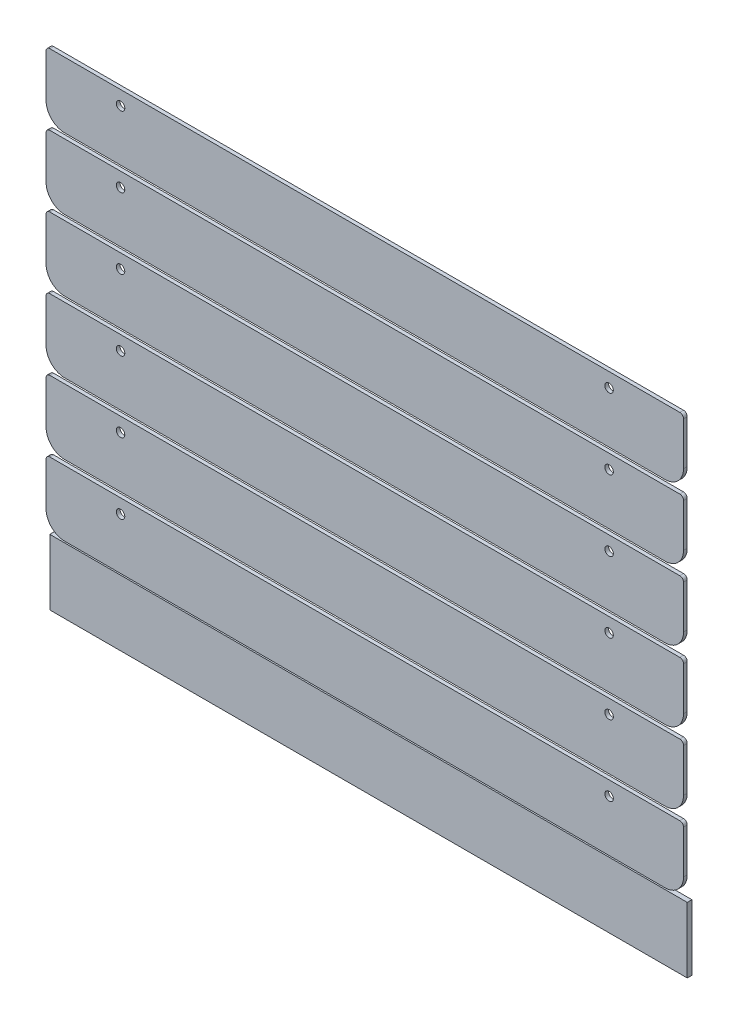
from build123d import *

# Parameters (mm, degrees)
SKETCH1_W             = 434.975
SKETCH1_H             = 44.704
BOSS_EXTRUDE1_DEPTH   = 3.175
SKETCH5_R             = 2.8956
BOSS_EXTRUDE4_DEPTH   = 2.54
BOSS_EXTRUDE4_2_DEPTH = 2.54
BOSS_EXTRUDE4_3_DEPTH = 2.54
BOSS_EXTRUDE4_4_DEPTH = 2.54
BOSS_EXTRUDE4_5_DEPTH = 2.54
BOSS_EXTRUDE4_6_DEPTH = 2.54


with BuildPart() as part:
    # Sketch1 → Boss-Extrude1 (new body)
    with BuildSketch(Plane.XY):
        Rectangle(SKETCH1_W, SKETCH1_H)
    extrude(amount=BOSS_EXTRUDE1_DEPTH)


with BuildPart() as body_2:
    # Sketch5 → Boss-Extrude4 (new body)
    with BuildSketch(Plane.XY.offset(3.175)):
        with BuildLine():
            Line((217.4875, 38.608), (217.4875, 68.072))
            ThreePointArc((217.4875, 68.072), (216.743551224, 69.868051224), (214.9475, 70.612))
            Line((214.9475, 70.612), (-214.9475, 70.612))
            ThreePointArc((-214.9475, 70.612), (-216.743551224, 69.868051224), (-217.4875, 68.072))
            Line((-217.4875, 68.072), (-217.4875, 38.608))
            ThreePointArc((-217.4875, 38.608), (-213.767756121, 29.627743879), (-204.7875, 25.908))
            Line((-204.7875, 25.908), (204.7875, 25.908))
            ThreePointArc((204.7875, 25.908), (213.767756121, 29.627743879), (217.4875, 38.608))
        make_face()
        with Locations((166.6875, 60.96)):
            Circle(SKETCH5_R, mode=Mode.SUBTRACT)
        with Locations((-166.6875, 60.96)):
            Circle(SKETCH5_R, mode=Mode.SUBTRACT)
    extrude(amount=BOSS_EXTRUDE4_DEPTH)


with BuildPart() as body_3:
    # Sketch5 → Boss-Extrude4 2 (new body)
    with BuildSketch(Plane.XY.offset(3.175)):
        with BuildLine():
            Line((217.4875, 86.868), (217.4875, 116.332))
            ThreePointArc((217.4875, 116.332), (216.743551224, 118.128051224), (214.9475, 118.872))
            Line((214.9475, 118.872), (-214.9475, 118.872))
            ThreePointArc((-214.9475, 118.872), (-216.743551224, 118.128051224), (-217.4875, 116.332))
            Line((-217.4875, 116.332), (-217.4875, 86.868))
            ThreePointArc((-217.4875, 86.868), (-213.767756121, 77.887743879), (-204.7875, 74.168))
            Line((-204.7875, 74.168), (204.7875, 74.168))
            ThreePointArc((204.7875, 74.168), (213.767756121, 77.887743879), (217.4875, 86.868))
        make_face()
        with Locations((166.6875, 109.22)):
            Circle(SKETCH5_R, mode=Mode.SUBTRACT)
        with Locations((-166.6875, 109.22)):
            Circle(SKETCH5_R, mode=Mode.SUBTRACT)
    extrude(amount=BOSS_EXTRUDE4_2_DEPTH)


with BuildPart() as body_4:
    # Sketch5 → Boss-Extrude4 3 (new body)
    with BuildSketch(Plane.XY.offset(3.175)):
        with BuildLine():
            Line((217.4875, 135.128), (217.4875, 164.592))
            ThreePointArc((217.4875, 164.592), (216.743551224, 166.388051224), (214.9475, 167.132))
            Line((214.9475, 167.132), (-214.9475, 167.132))
            ThreePointArc((-214.9475, 167.132), (-216.743551224, 166.388051224), (-217.4875, 164.592))
            Line((-217.4875, 164.592), (-217.4875, 135.128))
            ThreePointArc((-217.4875, 135.128), (-213.767756121, 126.147743879), (-204.7875, 122.428))
            Line((-204.7875, 122.428), (204.7875, 122.428))
            ThreePointArc((204.7875, 122.428), (213.767756121, 126.147743879), (217.4875, 135.128))
        make_face()
        with Locations((166.6875, 157.48)):
            Circle(SKETCH5_R, mode=Mode.SUBTRACT)
        with Locations((-166.6875, 157.48)):
            Circle(SKETCH5_R, mode=Mode.SUBTRACT)
    extrude(amount=BOSS_EXTRUDE4_3_DEPTH)


with BuildPart() as body_5:
    # Sketch5 → Boss-Extrude4 4 (new body)
    with BuildSketch(Plane.XY.offset(3.175)):
        with BuildLine():
            Line((217.4875, 183.388), (217.4875, 212.852))
            ThreePointArc((217.4875, 212.852), (216.743551224, 214.648051224), (214.9475, 215.392))
            Line((214.9475, 215.392), (-214.9475, 215.392))
            ThreePointArc((-214.9475, 215.392), (-216.743551224, 214.648051224), (-217.4875, 212.852))
            Line((-217.4875, 212.852), (-217.4875, 183.388))
            ThreePointArc((-217.4875, 183.388), (-213.767756121, 174.407743879), (-204.7875, 170.688))
            Line((-204.7875, 170.688), (204.7875, 170.688))
            ThreePointArc((204.7875, 170.688), (213.767756121, 174.407743879), (217.4875, 183.388))
        make_face()
        with Locations((166.6875, 205.74)):
            Circle(SKETCH5_R, mode=Mode.SUBTRACT)
        with Locations((-166.6875, 205.74)):
            Circle(SKETCH5_R, mode=Mode.SUBTRACT)
    extrude(amount=BOSS_EXTRUDE4_4_DEPTH)


with BuildPart() as body_6:
    # Sketch5 → Boss-Extrude4 5 (new body)
    with BuildSketch(Plane.XY.offset(3.175)):
        with BuildLine():
            Line((217.4875, 231.648), (217.4875, 261.112))
            ThreePointArc((217.4875, 261.112), (216.743551224, 262.908051224), (214.9475, 263.652))
            Line((214.9475, 263.652), (-214.9475, 263.652))
            ThreePointArc((-214.9475, 263.652), (-216.743551224, 262.908051224), (-217.4875, 261.112))
            Line((-217.4875, 261.112), (-217.4875, 231.648))
            ThreePointArc((-217.4875, 231.648), (-213.767756121, 222.667743879), (-204.7875, 218.948))
            Line((-204.7875, 218.948), (204.7875, 218.948))
            ThreePointArc((204.7875, 218.948), (213.767756121, 222.667743879), (217.4875, 231.648))
        make_face()
        with Locations((166.6875, 254)):
            Circle(SKETCH5_R, mode=Mode.SUBTRACT)
        with Locations((-166.6875, 254)):
            Circle(SKETCH5_R, mode=Mode.SUBTRACT)
    extrude(amount=BOSS_EXTRUDE4_5_DEPTH)


with BuildPart() as body_7:
    # Sketch5 → Boss-Extrude4 6 (new body)
    with BuildSketch(Plane.XY.offset(3.175)):
        with BuildLine():
            Line((217.4875, 279.908), (217.4875, 309.372))
            ThreePointArc((217.4875, 309.372), (216.743551224, 311.168051224), (214.9475, 311.912))
            Line((214.9475, 311.912), (-214.9475, 311.912))
            ThreePointArc((-214.9475, 311.912), (-216.743551224, 311.168051224), (-217.4875, 309.372))
            Line((-217.4875, 309.372), (-217.4875, 279.908))
            ThreePointArc((-217.4875, 279.908), (-213.767756121, 270.927743879), (-204.7875, 267.208))
            Line((-204.7875, 267.208), (204.7875, 267.208))
            ThreePointArc((204.7875, 267.208), (213.767756121, 270.927743879), (217.4875, 279.908))
        make_face()
        with Locations((166.6875, 302.26)):
            Circle(SKETCH5_R, mode=Mode.SUBTRACT)
        with Locations((-166.6875, 302.26)):
            Circle(SKETCH5_R, mode=Mode.SUBTRACT)
    extrude(amount=BOSS_EXTRUDE4_6_DEPTH)


solid = Compound([part.part, body_2.part, body_3.part, body_4.part, body_5.part, body_6.part, body_7.part])
